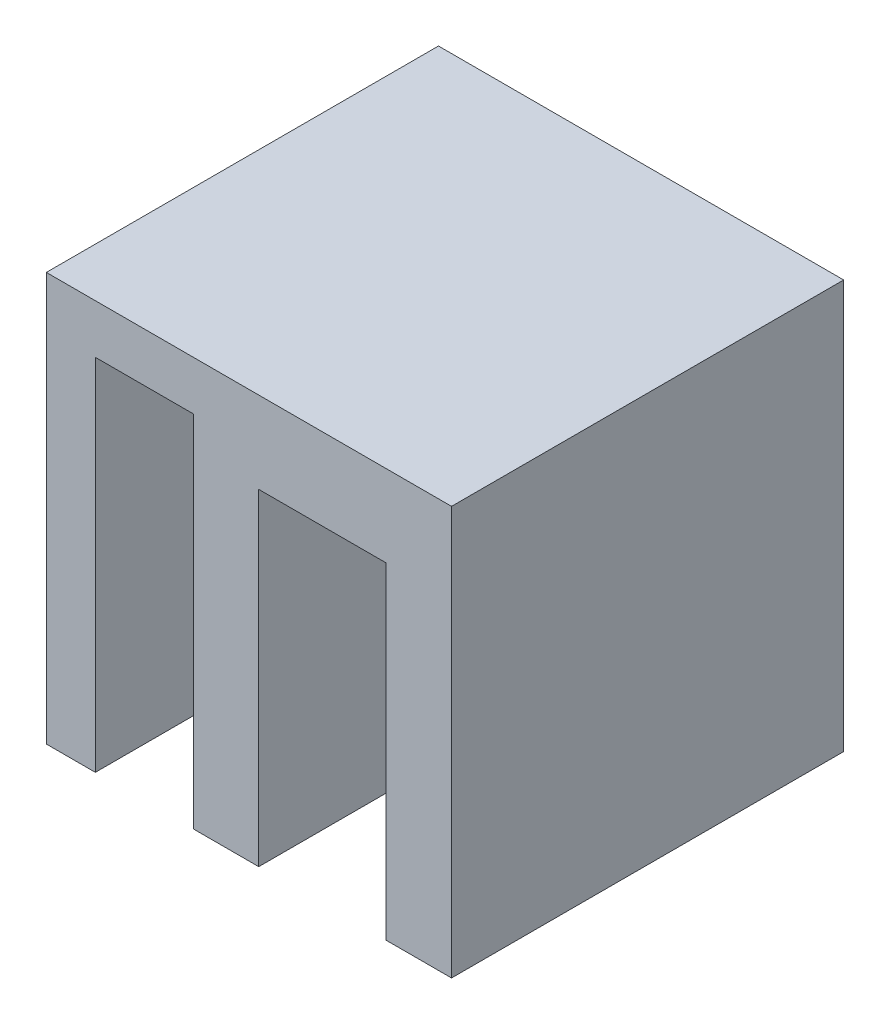
from build123d import *

# Parameters (mm, degrees)
BOSS_EXTRUDE1_DEPTH = 12


with BuildPart() as part:
    # Sketch1 → Boss-Extrude1 (new body)
    with BuildSketch(Plane.XY):
        Polygon((-3.9, -10), (-3.9, 0), (0, 0), (0, -10), (2, -10), (2, 2.5), (-5, 2.5), (-8, 2.5), (-10.4, 2.5), (-10.4, -10), (-8.9, -10), (-8.9, -1), (-8.9, 1), (-7, 1), (-5.9, 1), (-5.9, -10), align=None)
    extrude(amount=BOSS_EXTRUDE1_DEPTH)


solid = part.part
